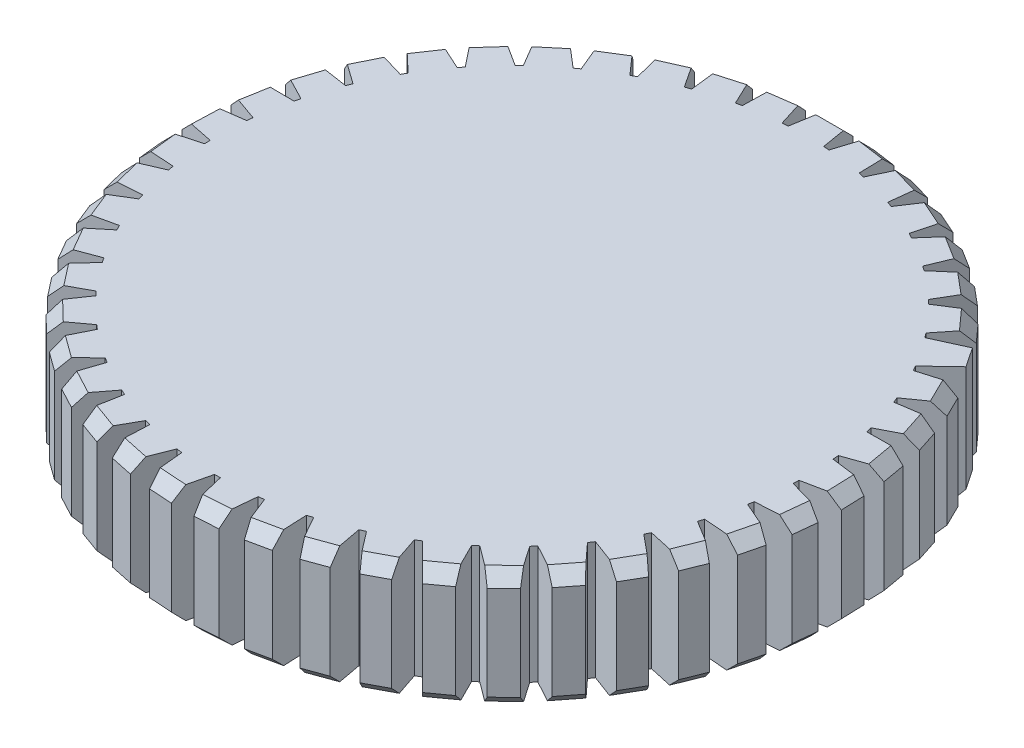
from build123d import *

# Parameters (mm, degrees)
SKETCH1_R           = 25
BOSS_EXTRUDE1_DEPTH = 10
BOSS_EXTRUDE2_START = -10
BOSS_EXTRUDE2_DEPTH = 10
CIRPATTERN4_COUNT   = 45
CHAMFER1_SIZE       = 1


with BuildPart() as part:
    # Sketch1 → Boss-Extrude1 (new body)
    with BuildSketch(Plane(origin=(0, 0, 0), x_dir=(1, 0, 0), z_dir=(0, 1, 0))):
        with Locations(Location((0, 0, 0), (0, 0, 270))):
            Circle(SKETCH1_R)
    extrude(amount=BOSS_EXTRUDE1_DEPTH)

    # Sketch2 → Boss-Extrude2 (add)
    with BuildSketch(Plane(origin=(0, 10, 0), x_dir=(1, 0, 0), z_dir=(0, 1, 0)).offset(BOSS_EXTRUDE2_START)):
        with BuildLine():
            ThreePointArc((-1.5, 24.954959427), (-0.750338033, 24.98873732), (0, 25))
            Line((0, 25), (0, 27.954959427))
            Line((0, 27.954959427), (-1, 27.954959427))
            Line((-1, 27.954959427), (-1.5, 24.954959427))
        make_face()
        with BuildLine():
            Line((0, 27.954959427), (0, 25))
            ThreePointArc((0, 25), (0.750338033, 24.98873732), (1.5, 24.954959427))
            Line((1.5, 24.954959427), (1, 27.954959427))
            Line((1, 27.954959427), (0, 27.954959427))
        make_face()
    boss_extrude2 = extrude(amount=BOSS_EXTRUDE2_DEPTH)

    # CirPattern4: Boss-Extrude2 ×45 about axis
    cirpattern4_axis = Axis((0, 0, 0), (0, 1, 0))
    for i in range(1, CIRPATTERN4_COUNT):
        add(boss_extrude2.rotate(cirpattern4_axis, i * 360 / CIRPATTERN4_COUNT))

    # Chamfer1
    chamfer1_edges = [part.edges().sort_by_distance(p)[0] for p in [
        (-25.125751097, 10, -12.254647622),
        (-25.125751097, 0, -12.254647622),
        (0, 0, -27.954959427),
        (-26.586746326, 10, -8.63855754),
        (-26.586746326, 0, -8.63855754),
        (-27.530260779, 10, -4.854327761),
        (-27.530260779, 0, -4.854327761),
        (-27.937930021, 10, -0.975614014),
        (-27.937930021, 0, -0.975614014),
        (-27.801819234, 10, 2.92208895),
        (-27.801819234, 0, 2.92208895),
        (-27.12457766, 10, 6.762916776),
        (-27.12457766, 0, 6.762916776),
        (-25.919387036, 10, 10.47211212),
        (-25.919387036, 0, 10.47211212),
        (-24.209705025, 10, 13.977479713),
        (-24.209705025, 0, 13.977479713),
        (-22.028808645, 10, 17.210791563),
        (-22.028808645, 0, 17.210791563),
        (-19.419146562, 10, 20.109114933),
        (-19.419146562, 0, 20.109114933),
        (-16.43151288, 10, 22.616037253),
        (-16.43151288, 0, 22.616037253),
        (-3.890578391, 10, -27.682903683),
        (-13.12405849, 10, 24.682764134),
        (-13.12405849, 0, 24.682764134),
        (-9.56115923, 10, 26.269069088),
        (-9.56115923, 0, 26.269069088),
        (-3.890578391, 0, -27.682903683),
        (-5.812162881, 10, 27.344076492),
        (-5.812162881, 0, 27.344076492),
        (-1.950039393, 10, 27.886862551),
        (-1.950039393, 0, 27.886862551),
        (1.950039393, 10, 27.886862551),
        (1.950039393, 0, 27.886862551),
        (5.812162881, 10, 27.344076492),
        (5.812162881, 0, 27.344076492),
        (9.56115923, 10, 26.269069088),
        (9.56115923, 0, 26.269069088),
        (13.12405849, 10, 24.682764134),
        (13.12405849, 0, 24.682764134),
        (16.43151288, 10, 22.616037253),
        (16.43151288, 0, 22.616037253),
        (19.419146562, 10, 20.109114933),
        (19.419146562, 0, 20.109114933),
        (-7.705431098, 10, -26.872031709),
        (22.028808645, 10, 17.210791563),
        (22.028808645, 0, 17.210791563),
        (24.209705025, 10, 13.977479713),
        (24.209705025, 0, 13.977479713),
        (-7.705431098, 0, -26.872031709),
        (25.919387036, 10, 10.47211212),
        (25.919387036, 0, 10.47211212),
        (27.12457766, 10, 6.762916776),
        (27.12457766, 0, 6.762916776),
        (27.801819234, 10, 2.92208895),
        (27.801819234, 0, 2.92208895),
        (27.937930021, 10, -0.975614014),
        (27.937930021, 0, -0.975614014),
        (27.530260779, 10, -4.854327761),
        (27.530260779, 0, -4.854327761),
        (26.586746326, 10, -8.63855754),
        (26.586746326, 0, -8.63855754),
        (25.125751097, 10, -12.254647622),
        (25.125751097, 0, -12.254647622),
        (23.175711704, 0, -15.632214928),
        (-11.370306355, 10, -25.538126203),
        (20.774583445, 10, -18.705518952),
        (20.774583445, 0, -18.705518952),
        (17.969101549, 10, -21.414741327),
        (17.969101549, 0, -21.414741327),
        (-11.370306355, 0, -25.538126203),
        (14.813871531, 10, -23.70715012),
        (14.813871531, 0, -23.70715012),
        (11.370306355, 10, -25.538126203),
        (11.370306355, 0, -25.538126203),
        (7.705431098, 10, -26.872031709),
        (7.705431098, 0, -26.872031709),
        (3.890578391, 10, -27.682903683),
        (3.890578391, 0, -27.682903683),
        (-14.813871531, 10, -23.70715012),
        (-14.813871531, 0, -23.70715012),
        (-17.969101549, 10, -21.414741327),
        (-17.969101549, 0, -21.414741327),
        (-20.774583445, 10, -18.705518952),
        (-20.774583445, 0, -18.705518952),
        (0, 10, -27.954959427),
        (-23.175711704, 10, -15.632214928),
        (-23.175711704, 0, -15.632214928),
    ]]
    chamfer(chamfer1_edges, length=CHAMFER1_SIZE)


solid = part.part
